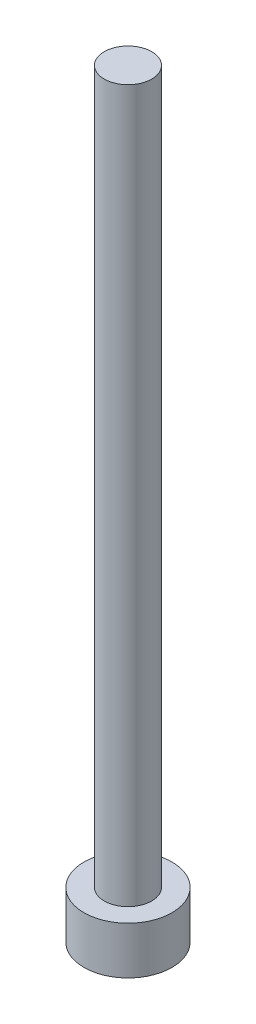
from build123d import *

# Parameters (mm, degrees)
SKETCH1_R           = 2.78
BOSS_EXTRUDE1_DEPTH = 3
SKETCH2_R           = 1.5
BOSS_EXTRUDE2_DEPTH = 45


with BuildPart() as part:
    # Sketch1 → Boss-Extrude1 (new body)
    with BuildSketch(Plane(origin=(0, 0, 0), x_dir=(1, 0, 0), z_dir=(0, 1, 0))):
        Circle(SKETCH1_R)
    extrude(amount=BOSS_EXTRUDE1_DEPTH)

    # Sketch2 → Boss-Extrude2 (add)
    with BuildSketch(Plane(origin=(0, 3, 0), x_dir=(1, 0, 0), z_dir=(0, 1, 0))):
        Circle(SKETCH2_R)
    extrude(amount=BOSS_EXTRUDE2_DEPTH)


solid = part.part
